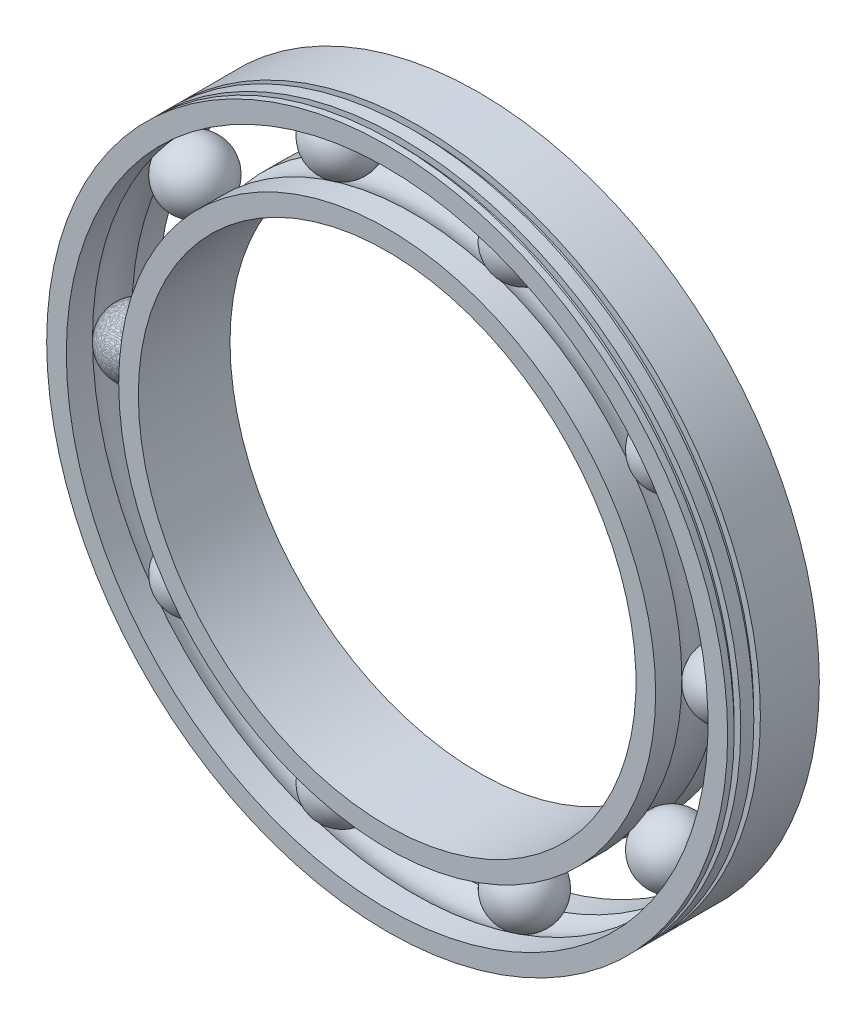
from build123d import *

# Parameters (mm, degrees)
CIRPATTERN1_COUNT   = 10
CIRPATTERN2_ANGLE   = 180
CIRPATTERN2_2_ANGLE = 180
CIRPATTERN2_3_ANGLE = 180
CIRPATTERN2_4_ANGLE = 180
CIRPATTERN2_5_ANGLE = 180
CIRPATTERN2_6_ANGLE = 180
CIRPATTERN2_7_ANGLE = 180
CIRPATTERN2_8_ANGLE = 180
CIRPATTERN2_9_ANGLE = 180


with BuildPart() as part:
    # Sketch2 → Revolve1 (revolve)
    with BuildSketch(Plane.XZ):
        with BuildLine():
            Line((-52.042412723, -7), (-49.042412723, -7))
            Line((-49.042412723, -7), (-49.042412723, -3))
            ThreePointArc((-49.042412723, -3), (-50.042412723, 0), (-49.042412723, 3))
            Line((-49.042412723, 3), (-49.042412723, 7))
            Line((-49.042412723, 7), (-52.042412723, 7))
            Line((-52.042412723, 7), (-52.042412723, 6))
            Line((-52.042412723, 6), (-51.042412723, 6))
            Line((-51.042412723, 6), (-51.042412723, 5))
            Line((-51.042412723, 5), (-52.042412723, 5))
            Line((-52.042412723, 5), (-52.042412723, 3))
            Line((-52.042412723, 3), (-51.042412723, 3))
            Line((-51.042412723, 3), (-51.042412723, 2))
            Line((-51.042412723, 2), (-52.042412723, 2))
            Line((-52.042412723, 2), (-52.042412723, -7))
        make_face()
        with BuildLine():
            Line((-38.042412723, -7), (-38.042412723, 7))
            Line((-38.042412723, 7), (-41.042412723, 7))
            Line((-41.042412723, 7), (-41.042412723, 3))
            ThreePointArc((-41.042412723, 3), (-40.042412723, 0), (-41.042412723, -3))
            Line((-41.042412723, -3), (-41.042412723, -7))
            Line((-41.042412723, -7), (-38.042412723, -7))
        make_face()
    revolve(axis=Axis((-0.042412723, 0, -20.515524483), (0, 0, 1)))


with BuildPart() as body_2:
    # Sketch3 → Revolve2 (revolve)
    with BuildSketch(Plane.XY):
        with BuildLine():
            Line((-45, 5), (-45, -5))
            ThreePointArc((-45, -5), (-40, 0), (-45, 5))
        make_face()
    revolve(axis=Axis((-45, 42.158378663, 0), (0, -1, 0)))


with BuildPart() as cirpattern1_1:
    # CirPattern1: pattern copy
    add(body_2.part.rotate(Axis((-19.44032735, 0, 0), (1, 0, 0)), 1 * 360 / CIRPATTERN1_COUNT))


with BuildPart() as cirpattern1_2:
    # CirPattern1: pattern copy
    add(body_2.part.rotate(Axis((-19.44032735, 0, 0), (1, 0, 0)), 2 * 360 / CIRPATTERN1_COUNT))


with BuildPart() as cirpattern1_3:
    # CirPattern1: pattern copy
    add(body_2.part.rotate(Axis((-19.44032735, 0, 0), (1, 0, 0)), 3 * 360 / CIRPATTERN1_COUNT))


with BuildPart() as cirpattern1_4:
    # CirPattern1: pattern copy
    add(body_2.part.rotate(Axis((-19.44032735, 0, 0), (1, 0, 0)), 4 * 360 / CIRPATTERN1_COUNT))


with BuildPart() as cirpattern1_5:
    # CirPattern1: pattern copy
    add(body_2.part.rotate(Axis((-19.44032735, 0, 0), (1, 0, 0)), 5 * 360 / CIRPATTERN1_COUNT))


with BuildPart() as cirpattern1_6:
    # CirPattern1: pattern copy
    add(body_2.part.rotate(Axis((-19.44032735, 0, 0), (1, 0, 0)), 6 * 360 / CIRPATTERN1_COUNT))


with BuildPart() as cirpattern1_7:
    # CirPattern1: pattern copy
    add(body_2.part.rotate(Axis((-19.44032735, 0, 0), (1, 0, 0)), 7 * 360 / CIRPATTERN1_COUNT))


with BuildPart() as cirpattern1_8:
    # CirPattern1: pattern copy
    add(body_2.part.rotate(Axis((-19.44032735, 0, 0), (1, 0, 0)), 8 * 360 / CIRPATTERN1_COUNT))


with BuildPart() as cirpattern1_9:
    # CirPattern1: pattern copy
    add(body_2.part.rotate(Axis((-19.44032735, 0, 0), (1, 0, 0)), 9 * 360 / CIRPATTERN1_COUNT))


with BuildPart() as body_12:
    # CirPattern2: read off the stored shape, not the designer's step
    # CirPattern2: copy of body 2
    add(body_2.part.rotate(Axis((0, 0, 0), (0.9510565163, 0.3090169944, 0)), CIRPATTERN2_ANGLE))


with BuildPart() as body_13:
    # CirPattern2 2: copy of body 2
    add(body_2.part.rotate(Axis((0, 0, 0), (0.8090169944, 0.5877852523, 0)), CIRPATTERN2_2_ANGLE))


with BuildPart() as body_14:
    # CirPattern2 3: copy of body 2
    add(body_2.part.rotate(Axis((0, 0, 0), (0.5877852523, 0.8090169944, 0)), CIRPATTERN2_3_ANGLE))


with BuildPart() as body_15:
    # CirPattern2 4: copy of body 2
    add(body_2.part.rotate(Axis((0, 0, 0), (0.3090169944, 0.9510565163, 0)), CIRPATTERN2_4_ANGLE))


with BuildPart() as body_16:
    # CirPattern2 5: copy of body 2
    add(body_2.part.rotate(Axis((0, 0, 0), (0, 1, 0)), CIRPATTERN2_5_ANGLE))


with BuildPart() as body_17:
    # CirPattern2 6: copy of body 2
    add(body_2.part.rotate(Axis((0, 0, 0), (0.3090169944, -0.9510565163, 0)), CIRPATTERN2_6_ANGLE))


with BuildPart() as body_18:
    # CirPattern2 7: copy of body 2
    add(body_2.part.rotate(Axis((0, 0, 0), (0.5877852523, -0.8090169944, 0)), CIRPATTERN2_7_ANGLE))


with BuildPart() as body_19:
    # CirPattern2 8: copy of body 2
    add(body_2.part.rotate(Axis((0, 0, 0), (0.8090169944, -0.5877852523, 0)), CIRPATTERN2_8_ANGLE))


with BuildPart() as body_20:
    # CirPattern2 9: copy of body 2
    add(body_2.part.rotate(Axis((0, 0, 0), (0.9510565163, -0.3090169944, 0)), CIRPATTERN2_9_ANGLE))


solid = Compound([part.part, body_2.part, cirpattern1_1.part, cirpattern1_2.part, cirpattern1_3.part, cirpattern1_4.part, cirpattern1_5.part, cirpattern1_6.part, cirpattern1_7.part, cirpattern1_8.part, cirpattern1_9.part, body_12.part, body_13.part, body_14.part, body_15.part, body_16.part, body_17.part, body_18.part, body_19.part, body_20.part])
